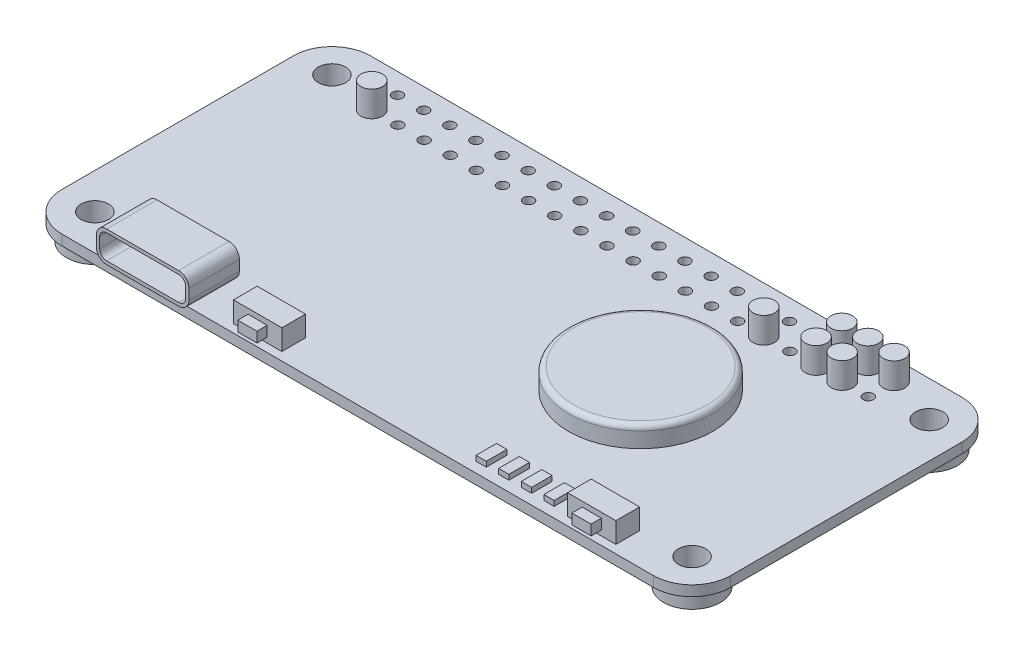
from build123d import *

# Parameters (mm, degrees)
BOSS_EXTRUDE1_DEPTH      = 1
SKETCH2_R                = 1.325
CUT_EXTRUDE1_DEPTH       = 36.80851854
SKETCH3_R                = 0.5
CUT_EXTRUDE2_DEPTH       = 36.80851854
LPATTERN1_COUNT          = 20
LPATTERN1_PITCH          = 2.54
BOSS_EXTRUDE6_DEPTH      = 0.4
BOSS_EXTRUDE6_DEPTH_BACK = 4.5
CUT_EXTRUDE9_DEPTH       = 5.25
SKETCH_1_W               = 4.7
SKETCH_1_H               = 2.3
EXTRUDE_1_DEPTH          = 2
SKETCH_2_W               = 1.86
SKETCH_2_H               = 1
EXTRUDE_2_DEPTH          = 1
SKETCH_9_R               = 2.75
SKETCH_9_R_2             = 1.325
EXTRUDE_8_DEPTH          = 1.5
SKETCH_10_R              = 1.05
EXTRUDE_9_DEPTH          = 2.5
SKETCH_11_R              = 0.5
EXTRUDE_10_DEPTH         = 3
SKETCH_12_R              = 7
EXTRUDE_11_DEPTH         = 2
SKETCH_13_W              = 1
SKETCH_13_H              = 2
EXTRUDE_12_DEPTH         = 0.5
FILLET_1_R               = 0.5
EXTRUDE_13_DEPTH         = 1


with BuildPart() as part:
    # Sketch1 → Boss-Extrude1 (new body)
    with BuildSketch(Plane(origin=(0, 0, 0), x_dir=(1, 0, 0), z_dir=(0, 1, 0))):
        with BuildLine():
            Line((-28.75, 15), (28.75, 15))
            ThreePointArc((28.75, 15), (31.401650429, 13.901650429), (32.5, 11.25))
            Line((32.5, 11.25), (32.5, -11.25))
            ThreePointArc((32.5, -11.25), (31.401650429, -13.901650429), (28.75, -15))
            Line((28.75, -15), (-28.75, -15))
            ThreePointArc((-28.75, -15), (-31.401650429, -13.901650429), (-32.5, -11.25))
            Line((-32.5, -11.25), (-32.5, 11.25))
            ThreePointArc((-32.5, 11.25), (-31.401650429, 13.901650429), (-28.75, 15))
        make_face()
    extrude(amount=BOSS_EXTRUDE1_DEPTH)

    # Sketch2 → Cut-Extrude1 (cut, through all)
    with BuildSketch(Plane(origin=(0, 1, 0), x_dir=(1, 0, 0), z_dir=(0, 1, 0))):
        with Locations((-29.025, 11.525)):
            Circle(SKETCH2_R)
        with Locations((29.025, 11.525)):
            Circle(SKETCH2_R)
        with Locations((29.025, -11.525)):
            Circle(SKETCH2_R)
        with Locations((-29.025, -11.525)):
            Circle(SKETCH2_R)
    extrude(amount=-CUT_EXTRUDE1_DEPTH, mode=Mode.SUBTRACT)

    # Sketch3 → Cut-Extrude2 (cut, through all)
    with BuildSketch(Plane(origin=(0, 1, 0), x_dir=(1, 0, 0), z_dir=(0, 1, 0))):
        with Locations((-24.128, 13)):
            Circle(SKETCH3_R)
        with Locations((-24.128, 10.5)):
            Circle(SKETCH3_R)
    cut_extrude2 = extrude(amount=-CUT_EXTRUDE2_DEPTH, mode=Mode.SUBTRACT)

    # LPattern1: Cut-Extrude2 ×20
    with Locations(*[(i * LPATTERN1_PITCH, 0, 0) for i in range(1, LPATTERN1_COUNT)]):
        add(cut_extrude2, mode=Mode.SUBTRACT)

    # Sketch15 → Boss-Extrude6 (add, two sides: drawn at the far end of the back side and taken through both)
    with BuildSketch(Plane.XY.offset(15).offset(-BOSS_EXTRUDE6_DEPTH_BACK)):
        with BuildLine():
            Line((-24, 4), (-17, 4))
            ThreePointArc((-17, 4), (-16.292893219, 3.707106781), (-16, 3))
            Line((-16, 3), (-16, 2))
            ThreePointArc((-16, 2), (-16.292893219, 1.292893219), (-17, 1))
            Line((-17, 1), (-24, 1))
            ThreePointArc((-24, 1), (-24.707106781, 1.292893219), (-25, 2))
            Line((-25, 2), (-25, 3))
            ThreePointArc((-25, 3), (-24.707106781, 3.707106781), (-24, 4))
        make_face()
    extrude(amount=BOSS_EXTRUDE6_DEPTH + BOSS_EXTRUDE6_DEPTH_BACK)

    # Sketch16 → Cut-Extrude9 (cut)
    with BuildSketch(Plane.XY.offset(15.4)):
        with BuildLine():
            Line((-17, 3.68), (-24, 3.68))
            ThreePointArc((-24, 3.68), (-24.480832611, 3.480832611), (-24.68, 3))
            Line((-24.68, 3), (-24.68, 2))
            ThreePointArc((-24.68, 2), (-24.480832611, 1.519167389), (-24, 1.32))
            Line((-24, 1.32), (-17, 1.32))
            ThreePointArc((-17, 1.32), (-16.519167389, 1.519167389), (-16.32, 2))
            Line((-16.32, 2), (-16.32, 3))
            ThreePointArc((-16.32, 3), (-16.519167389, 3.480832611), (-17, 3.68))
        make_face()
    extrude(amount=-CUT_EXTRUDE9_DEPTH, mode=Mode.SUBTRACT)

    # 草图1 → 凸台-拉伸1 (add)
    with BuildSketch(Plane(origin=(0, 1, 0), x_dir=(1, 0, 0), z_dir=(0, 1, 0))):
        with Locations((-10.52, -13.05)):
            Rectangle(SKETCH_1_W, SKETCH_1_H)
        with Locations((21.95, -13.05)):
            Rectangle(SKETCH_1_W, SKETCH_1_H)
    extrude(amount=EXTRUDE_1_DEPTH)

    # 草图2 → 凸台-拉伸2 (add)
    with BuildSketch(Plane.XY.offset(14.2)):
        with Locations((-10.52, 2)):
            Rectangle(SKETCH_2_W, SKETCH_2_H)
        with Locations((21.95, 2)):
            Rectangle(SKETCH_2_W, SKETCH_2_H)
    extrude(amount=EXTRUDE_2_DEPTH)

    # 草图9 → 凸台-拉伸8 (add)
    # profile 1 of 4: a face of its own
    with BuildSketch(Plane.XZ):
        with Locations((29.025, 11.525)):
            Circle(SKETCH_9_R)
        with Locations((29.025, 11.525)):
            Circle(SKETCH_9_R_2, mode=Mode.SUBTRACT)
    # profile 2 of 4: a face of its own
    with BuildSketch(Plane.XZ):
        with Locations((29.025, -11.525)):
            Circle(SKETCH_9_R)
        with Locations((29.025, -11.525)):
            Circle(SKETCH_9_R_2, mode=Mode.SUBTRACT)
    # profile 3 of 4: a face of its own
    with BuildSketch(Plane.XZ):
        with Locations((-29.025, 11.525)):
            Circle(SKETCH_9_R)
        with Locations((-29.025, 11.525)):
            Circle(SKETCH_9_R_2, mode=Mode.SUBTRACT)
    # profile 4 of 4: a face of its own
    with BuildSketch(Plane.XZ):
        with Locations((-29.025, -11.525)):
            Circle(SKETCH_9_R)
        with Locations((-29.025, -11.525)):
            Circle(SKETCH_9_R_2, mode=Mode.SUBTRACT)
    extrude(amount=EXTRUDE_8_DEPTH)

    # 草图10 → 凸台-拉伸9 (add)
    with BuildSketch(Plane(origin=(0, 1, 0), x_dir=(1, 0, 0), z_dir=(0, 1, 0))):
        with Locations((24.132, 13)):
            Circle(SKETCH_10_R)
        with Locations((21.592, 13)):
            Circle(SKETCH_10_R)
        with Locations((19.052, 13)):
            Circle(SKETCH_10_R)
        with Locations((21.592, 10.5)):
            Circle(SKETCH_10_R)
        with Locations((19.052, 10.5)):
            Circle(SKETCH_10_R)
        with Locations((-24.128, 10.5)):
            Circle(SKETCH_10_R)
        with Locations((13.972, 10.5)):
            Circle(SKETCH_10_R)
    extrude(amount=EXTRUDE_9_DEPTH)

    # 草图11 → 凸台-拉伸10 (add)
    with BuildSketch(Plane.XZ.offset(-1)):
        with Locations((24.132, -13)):
            Circle(SKETCH_11_R)
        with Locations((21.592, -13)):
            Circle(SKETCH_11_R)
        with Locations((21.592, -10.5)):
            Circle(SKETCH_11_R)
        with Locations((19.052, -10.5)):
            Circle(SKETCH_11_R)
        with Locations((19.052, -13)):
            Circle(SKETCH_11_R)
        with Locations((-24.128, -10.5)):
            Circle(SKETCH_11_R)
    extrude(amount=EXTRUDE_10_DEPTH)

    # 草图12 → 凸台-拉伸11 (add)
    with BuildSketch(Plane(origin=(0, 1, 0), x_dir=(1, 0, 0), z_dir=(0, 1, 0))):
        with Locations((12.5, 0)):
            Circle(SKETCH_12_R)
    extrude(amount=EXTRUDE_11_DEPTH)

    # 草图13 → 凸台-拉伸12 (add)
    with BuildSketch(Plane(origin=(0, 1, 0), x_dir=(1, 0, 0), z_dir=(0, 1, 0))):
        with Locations((17.6, -13)):
            Rectangle(SKETCH_13_W, SKETCH_13_H)
        with Locations((15.4, -13)):
            Rectangle(SKETCH_13_W, SKETCH_13_H)
        with Locations((13.2, -13)):
            Rectangle(SKETCH_13_W, SKETCH_13_H)
        with Locations((11, -13)):
            Rectangle(SKETCH_13_W, SKETCH_13_H)
    extrude(amount=EXTRUDE_12_DEPTH)

    # 圆角1
    fillet_1_edges = [part.edges().sort_by_distance(p)[0] for p in [
        (5.5, 3, 0),
    ]]
    fillet(fillet_1_edges, radius=FILLET_1_R)

    # 草图14 → 凸台-拉伸13 (add)
    with BuildSketch(Plane(origin=(0, 0, 10.5), x_dir=(-1, 0, 0), z_dir=(0, 0, -1))):
        with BuildLine():
            Line((16, 3), (16, 2))
            ThreePointArc((16, 2), (16.292893219, 1.292893219), (17, 1))
            Line((17, 1), (24, 1))
            ThreePointArc((24, 1), (24.707106781, 1.292893219), (25, 2))
            Line((25, 2), (25, 3))
            ThreePointArc((25, 3), (24.707106781, 3.707106781), (24, 4))
            Line((24, 4), (17, 4))
            ThreePointArc((17, 4), (16.292893219, 3.707106781), (16, 3))
        make_face()
    extrude(amount=-EXTRUDE_13_DEPTH)


solid = part.part
